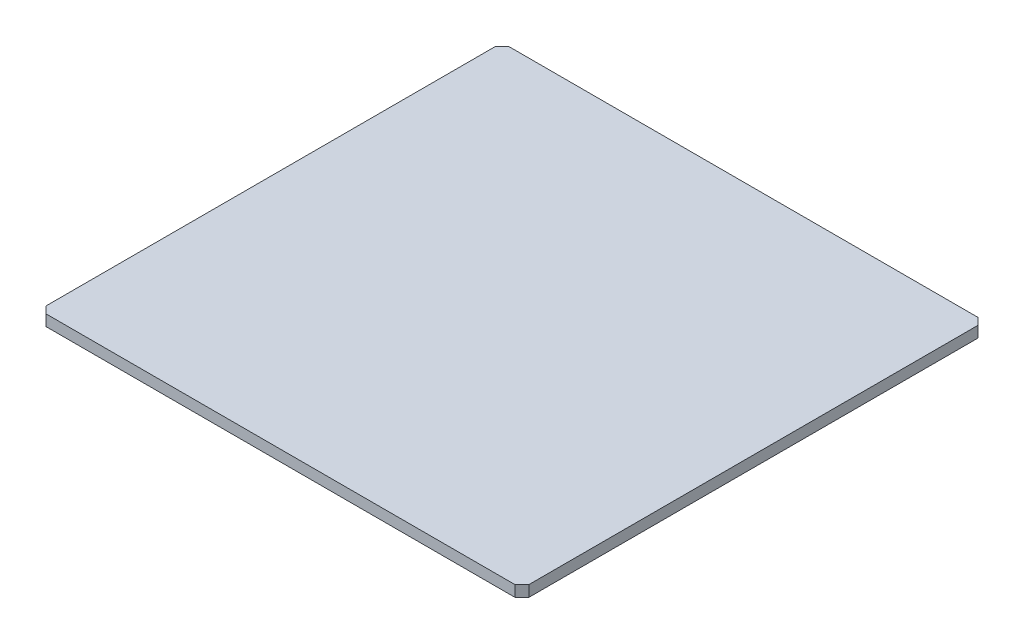
from build123d import *

# Parameters (mm, degrees)
BOSS_EXTRUDE1_DEPTH = 2.286


with BuildPart() as part:
    # Sketch1 → Boss-Extrude1 (new body)
    with BuildSketch(Plane(origin=(0, 0, 0), x_dir=(1, 0, 0), z_dir=(0, 1, 0))):
        Polygon((0.15, 94.185786438), (1.564213562, 95.6), (98.435786438, 95.6), (99.85, 94.185786438), (99.85, 1.414213562), (98.435786438, 0), (1.564213562, 0), (0.15, 1.414213562), align=None)
    extrude(amount=BOSS_EXTRUDE1_DEPTH)


solid = part.part
